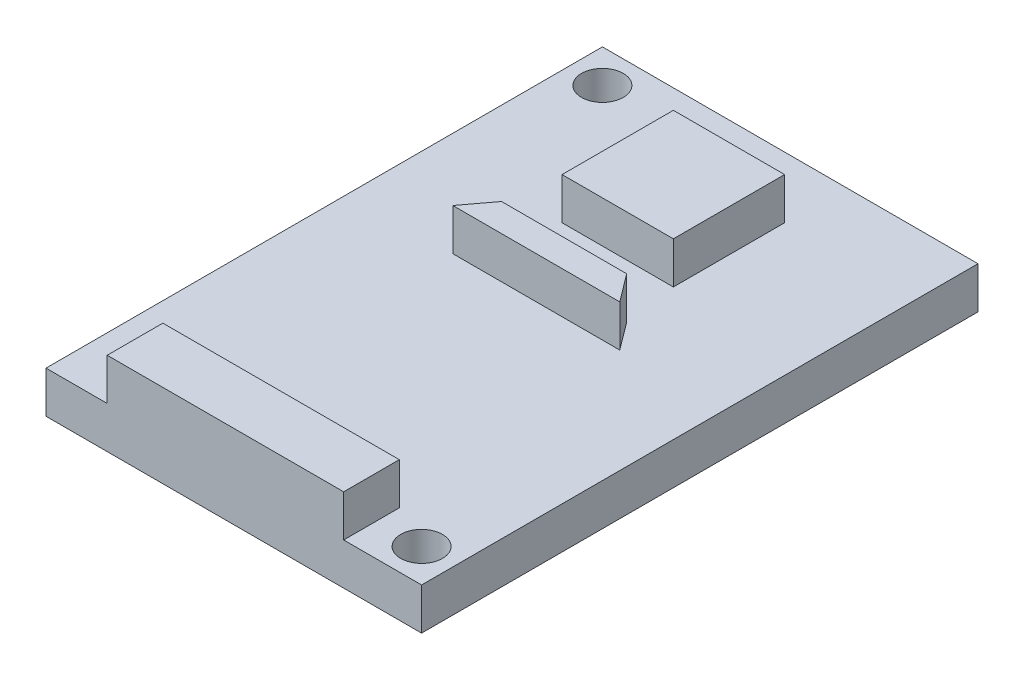
from build123d import *

# Parameters (mm, degrees)
SKETCH1_W           = 13.5
SKETCH1_H           = 20
BOSS_EXTRUDE1_DEPTH = 1.5
SKETCH2_W           = 4
SKETCH2_H           = 4
BOSS_EXTRUDE2_DEPTH = 1.5
SKETCH3_R           = 0.75
CUT_EXTRUDE1_DEPTH  = 1.5
SKETCH4_W           = 8.5
SKETCH4_H           = 2
BOSS_EXTRUDE3_DEPTH = 1.5


with BuildPart() as part:
    # Sketch1 → Boss-Extrude1 (new body)
    with BuildSketch(Plane(origin=(0, 0, 0), x_dir=(1, 0, 0), z_dir=(0, 1, 0))):
        with Locations((6.75, 10)):
            Rectangle(SKETCH1_W, SKETCH1_H)
    extrude(amount=BOSS_EXTRUDE1_DEPTH)

    # Sketch2 → Boss-Extrude2 (add)
    with BuildSketch(Plane(origin=(0, 1.5, 0), x_dir=(1, 0, 0), z_dir=(0, 1, 0))):
        with Locations((6.75, 15.8)):
            Rectangle(SKETCH2_W, SKETCH2_H)
        Polygon((4.5, 11.87318686), (9, 11.87318686), (9.75, 10.87318686), (3.75, 10.87318686), align=None)
    extrude(amount=BOSS_EXTRUDE2_DEPTH)

    # Sketch3 → Cut-Extrude1 (cut)
    with BuildSketch(Plane.XZ):
        with Locations((1.2, -18.8)):
            Circle(SKETCH3_R)
        with Locations((12.3, -1.2)):
            Circle(SKETCH3_R)
    extrude(amount=-CUT_EXTRUDE1_DEPTH, mode=Mode.SUBTRACT)

    # Sketch4 → Boss-Extrude3 (add)
    with BuildSketch(Plane(origin=(0, 1.5, 0), x_dir=(1, 0, 0), z_dir=(0, 1, 0))):
        with Locations((6.45, 1)):
            Rectangle(SKETCH4_W, SKETCH4_H)
    extrude(amount=BOSS_EXTRUDE3_DEPTH)


solid = part.part
